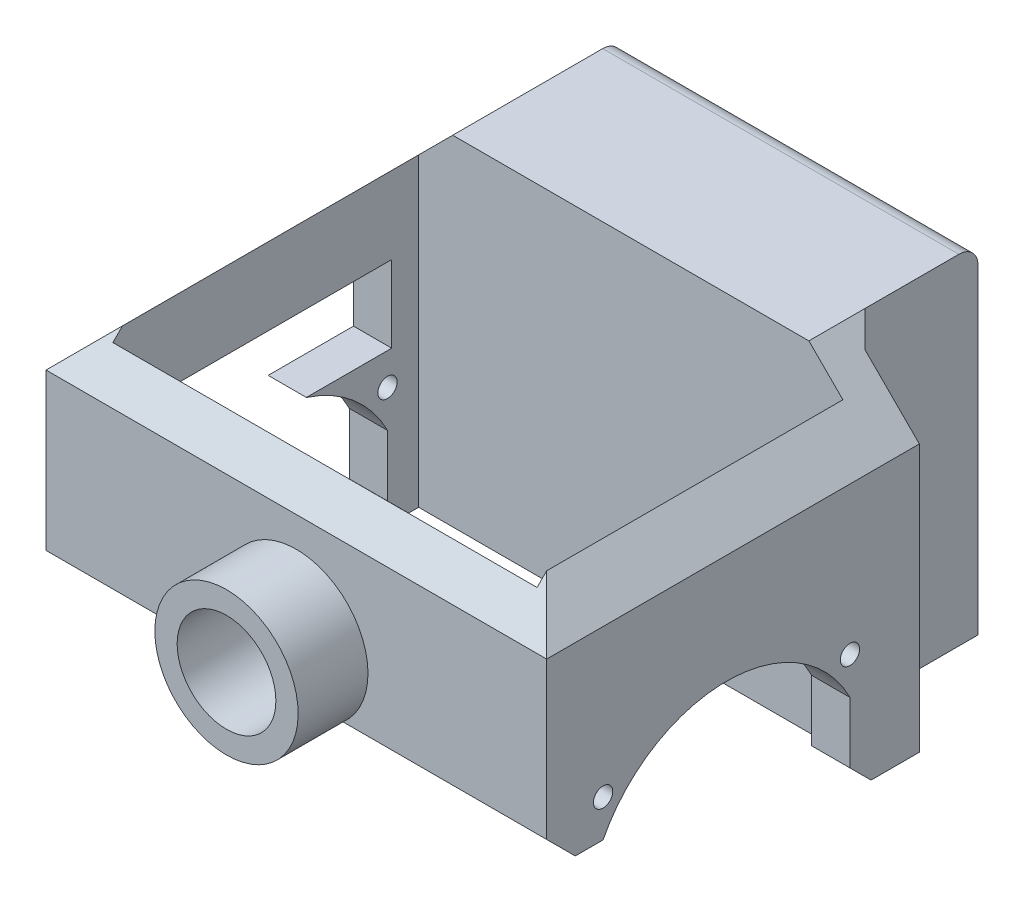
from build123d import *

# Parameters (mm, degrees)
SKETCH1_W                       = 25
SKETCH1_H                       = 30
BOSS_EXTRUDE1_DEPTH             = 3.175
SKETCH2_W                       = 25
SKETCH2_H                       = 3.175
BOSS_EXTRUDE2_DEPTH             = 41.58
SKETCH3_W                       = 3.175
SKETCH3_H                       = 25
BOSS_EXTRUDE3_DEPTH             = 30
CUT_EXTRUDE1_REACH              = 60.775
SKETCH4_R                       = 11.5
CUT_EXTRUDE2_REACH              = 60.775
SKETCH5_R                       = 0.8
CUT_EXTRUDE3_REACH              = 60.775
SKETCH6_R                       = 0.8
SKETCH6_R_2                     = 0.799851166
SKETCH6_W                       = 21.2
SKETCH6_H                       = 6.375
CUT_EXTRUDE4_REACH              = 60.775
SKETCH7_R                       = 11.5
BOSS_EXTRUDE4_DEPTH             = 0.2
SKETCH9_W                       = 41.58
SKETCH9_H                       = 33.175
BOSS_EXTRUDE5_DEPTH             = 3.175
BOSS_EXTRUDE6_DEPTH             = 0.2
SKETCH11_W                      = 41.58
SKETCH11_H                      = 33.175
BOSS_EXTRUDE7_DEPTH             = 3.175
CHAMFER1_SIZE                   = 3.175
CHAMFER2_SIZE                   = 3.175
SKETCH13_W                      = 29.58
SKETCH13_H                      = 3.175
BOSS_EXTRUDE8_DEPTH             = 7.695
BOSS_EXTRUDE9_REACH             = 59.968
SKETCH14_W                      = 29.58
SKETCH14_H                      = 3.5
BOSS_EXTRUDE9_DIRECTION_2_DEPTH = 25
FILLET1_R                       = 1.5875
FILLET2_R                       = 1.5875
CUT_EXTRUDE5_REACH              = 70.161
SKETCH16_R                      = 7.1
SKETCH20_R                      = 8
SKETCH20_R_2                    = 4.1
BOSS_EXTRUDE11_DEPTH            = 5
CUT_EXTRUDE6_START              = -21.7275
SKETCH21_R                      = 1.025
CUT_EXTRUDE6_DEPTH              = 16
BOSS_EXTRUDE12_DEPTH            = 5
BOSS_EXTRUDE12_DEPTH_BACK       = 1.2
SKETCH23_R                      = 5.95
SKETCH23_R_2                    = 4.1
CUT_EXTRUDE9_START              = -0.8
SKETCH35_W                      = 56.674577384
SKETCH35_H                      = 32.233153273
SKETCH35_R                      = 5.95
CUT_EXTRUDE9_DEPTH              = 0.8
CHAMFER4_SIZE                   = 1.5
SKETCH24_R                      = 11.5
SKETCH24_R_2                    = 10
BOSS_EXTRUDE13_DEPTH            = 1.8
SKETCH25_W                      = 108.105246784
SKETCH25_H                      = 63.591321638
CUT_EXTRUDE7_DEPTH              = 11.825
CHAMFER5_SIZE                   = 6
CUT_EXTRUDE8_START              = -3.175
SKETCH26_R                      = 4.1
CUT_EXTRUDE8_DEPTH              = 3.175
BOSS_EXTRUDE14_START            = 1.975
BOSS_EXTRUDE14_DEPTH            = 1.975
BOSS_EXTRUDE16_START            = 3.5
SKETCH29_R                      = 7.1
SKETCH29_R_2                    = 4.1
BOSS_EXTRUDE16_DEPTH            = 3.5
BOSS_EXTRUDE17_REACH            = 66.275
SKETCH31_W                      = 3.175
SKETCH31_H                      = 26.839044126
BOSS_EXTRUDE18_DEPTH            = 6.825
SKETCH34_R                      = 8
BOSS_EXTRUDE19_DEPTH            = 2.37
CHAMFER7_SIZE                   = 3.175
CHAMFER8_SIZE                   = 1.75


# Some blends are built 0.0001 mm under size
with BuildPart() as part:
    # Sketch1 → Boss-Extrude1 (new body)
    with BuildSketch(Plane(origin=(0, 0, 0), x_dir=(0, 0, -1), z_dir=(1, 0, 0))):
        with Locations((12.5, 15)):
            Rectangle(SKETCH1_W, SKETCH1_H)
    extrude(amount=BOSS_EXTRUDE1_DEPTH)

    # Sketch2 → Boss-Extrude2 (add)
    with BuildSketch(Plane.ZY):
        with Locations((-12.5, 31.5875)):
            Rectangle(SKETCH2_W, SKETCH2_H)
    extrude(amount=-BOSS_EXTRUDE2_DEPTH)

    # Sketch3 → Boss-Extrude3 (add)
    with BuildSketch(Plane.XZ.offset(-30)):
        with Locations((39.9925, -12.5)):
            Rectangle(SKETCH3_W, SKETCH3_H)
    extrude(amount=BOSS_EXTRUDE3_DEPTH)

    # Sketch4 → Cut-Extrude1 (cut, up to next)
    with BuildSketch(Plane.ZY, mode=Mode.PRIVATE) as cut_extrude1_sk1:
        with Locations((-12.359999929, -5.209996254)):
            Circle(SKETCH4_R)
    cut_extrude1_tool1 = extrude(cut_extrude1_sk1.sketch, amount=-CUT_EXTRUDE1_REACH, mode=Mode.PRIVATE) & part.part
    add(cut_extrude1_tool1.solids().sort_by_distance((0, -5.209996, -12.36))[0], mode=Mode.SUBTRACT)

    # Sketch5 → Cut-Extrude2 (cut, up to next)
    with BuildSketch(Plane.ZY, mode=Mode.PRIVATE) as cut_extrude2_sk1:
        with Locations((-22.609999929, 3.090003746)):
            Circle(SKETCH5_R)
    cut_extrude2_tool1 = extrude(cut_extrude2_sk1.sketch, amount=-CUT_EXTRUDE2_REACH, mode=Mode.PRIVATE) & part.part
    # Sketch5 → Cut-Extrude2 (cut, up to next)
    with BuildSketch(Plane.ZY, mode=Mode.PRIVATE) as cut_extrude2_sk2:
        with Locations((-22.609999929, 23.790003746)):
            Circle(SKETCH5_R)
    cut_extrude2_tool2 = extrude(cut_extrude2_sk2.sketch, amount=-CUT_EXTRUDE2_REACH, mode=Mode.PRIVATE) & part.part
    # Sketch5 → Cut-Extrude2 (cut, up to next)
    with BuildSketch(Plane.ZY, mode=Mode.PRIVATE) as cut_extrude2_sk3:
        with Locations((-2.109999929, 23.790003746)):
            Circle(SKETCH5_R)
    cut_extrude2_tool3 = extrude(cut_extrude2_sk3.sketch, amount=-CUT_EXTRUDE2_REACH, mode=Mode.PRIVATE) & part.part
    # Sketch5 → Cut-Extrude2 (cut, up to next)
    with BuildSketch(Plane.ZY, mode=Mode.PRIVATE) as cut_extrude2_sk4:
        with Locations((-2.109999929, 3.090003746)):
            Circle(SKETCH5_R)
    cut_extrude2_tool4 = extrude(cut_extrude2_sk4.sketch, amount=-CUT_EXTRUDE2_REACH, mode=Mode.PRIVATE) & part.part
    add(cut_extrude2_tool1.solids().sort_by_distance((0, 3.090004, -22.61))[0], mode=Mode.SUBTRACT)
    add(cut_extrude2_tool2.solids().sort_by_distance((0, 23.790004, -22.61))[0], mode=Mode.SUBTRACT)
    add(cut_extrude2_tool3.solids().sort_by_distance((0, 23.790004, -2.11))[0], mode=Mode.SUBTRACT)
    add(cut_extrude2_tool4.solids().sort_by_distance((0, 3.090004, -2.11))[0], mode=Mode.SUBTRACT)

    # Sketch6 → Cut-Extrude3 (cut, up to next)
    with BuildSketch(Plane(origin=(41.58, 0, 0), x_dir=(0, 0, -1), z_dir=(1, 0, 0)), mode=Mode.PRIVATE) as cut_extrude3_sk1:
        with Locations(Location((2.109999929, 3.090003746, 0), (0, 0, 180))):
            Circle(SKETCH6_R)
    cut_extrude3_tool1 = extrude(cut_extrude3_sk1.sketch, amount=-CUT_EXTRUDE3_REACH, mode=Mode.PRIVATE) & part.part
    # Sketch6 → Cut-Extrude3 (cut, up to next)
    with BuildSketch(Plane(origin=(41.58, 0, 0), x_dir=(0, 0, -1), z_dir=(1, 0, 0)), mode=Mode.PRIVATE) as cut_extrude3_sk2:
        with Locations(Location((22.609999929, 3.090003746, 0), (0, 0, 180))):
            Circle(SKETCH6_R)
    cut_extrude3_tool2 = extrude(cut_extrude3_sk2.sketch, amount=-CUT_EXTRUDE3_REACH, mode=Mode.PRIVATE) & part.part
    # Sketch6 → Cut-Extrude3 (cut, up to next)
    with BuildSketch(Plane(origin=(41.58, 0, 0), x_dir=(0, 0, -1), z_dir=(1, 0, 0)), mode=Mode.PRIVATE) as cut_extrude3_sk3:
        with Locations((22.609999929, 27.540003746)):
            Circle(SKETCH6_R_2)
    cut_extrude3_tool3 = extrude(cut_extrude3_sk3.sketch, amount=-CUT_EXTRUDE3_REACH, mode=Mode.PRIVATE) & part.part
    # Sketch6 → Cut-Extrude3 (cut, up to next)
    with BuildSketch(Plane(origin=(41.58, 0, 0), x_dir=(0, 0, -1), z_dir=(1, 0, 0)), mode=Mode.PRIVATE) as cut_extrude3_sk4:
        with Locations((2.109999929, 27.540003746)):
            Circle(SKETCH6_R)
    cut_extrude3_tool4 = extrude(cut_extrude3_sk4.sketch, amount=-CUT_EXTRUDE3_REACH, mode=Mode.PRIVATE) & part.part
    # Sketch6 → Cut-Extrude3 (cut, up to next)
    with BuildSketch(Plane(origin=(41.58, 0, 0), x_dir=(0, 0, -1), z_dir=(1, 0, 0)), mode=Mode.PRIVATE) as cut_extrude3_sk5:
        with Locations((12.359999929, 8.927503746)):
            Rectangle(SKETCH6_W, SKETCH6_H)
    cut_extrude3_tool5 = extrude(cut_extrude3_sk5.sketch, amount=-CUT_EXTRUDE3_REACH, mode=Mode.PRIVATE) & part.part
    add(cut_extrude3_tool1.solids().sort_by_distance((41.58, 3.090004, -2.11))[0], mode=Mode.SUBTRACT)
    add(cut_extrude3_tool2.solids().sort_by_distance((41.58, 3.090004, -22.61))[0], mode=Mode.SUBTRACT)
    add(cut_extrude3_tool3.solids().sort_by_distance((41.58, 27.540004, -22.61))[0], mode=Mode.SUBTRACT)
    add(cut_extrude3_tool4.solids().sort_by_distance((41.58, 27.540004, -2.11))[0], mode=Mode.SUBTRACT)
    add(cut_extrude3_tool5.solids().sort_by_distance((41.58, 8.927504, -12.36))[0], mode=Mode.SUBTRACT)

    # Sketch7 → Cut-Extrude4 (cut, up to next)
    with BuildSketch(Plane(origin=(41.58, 0, 0), x_dir=(0, 0, -1), z_dir=(1, 0, 0)), mode=Mode.PRIVATE) as cut_extrude4_sk1:
        with Locations((12.359999929, -5.209996254)):
            Circle(SKETCH7_R)
    cut_extrude4_tool1 = extrude(cut_extrude4_sk1.sketch, amount=-CUT_EXTRUDE4_REACH, mode=Mode.PRIVATE) & part.part
    add(cut_extrude4_tool1.solids().sort_by_distance((41.58, -5.209996, -12.36))[0], mode=Mode.SUBTRACT)

    # Sketch8 → Boss-Extrude4 (add)
    with BuildSketch(Plane.XY):
        Polygon((0, 33.175), (0, 0), (3.175, 0), (3.175, 30), (38.405, 30), (38.405, 0), (41.58, 0), (41.58, 33.175), align=None)
    extrude(amount=BOSS_EXTRUDE4_DEPTH)

    # Sketch9 → Boss-Extrude5 (add)
    with BuildSketch(Plane.XY.offset(0.2)):
        with Locations((20.79, 16.5875)):
            Rectangle(SKETCH9_W, SKETCH9_H)
    extrude(amount=BOSS_EXTRUDE5_DEPTH)

    # Sketch10 → Boss-Extrude6 (add)
    with BuildSketch(Plane(origin=(0, 0, -25), x_dir=(-1, 0, 0), z_dir=(0, 0, -1))):
        Polygon((0, 0), (0, 33.175), (-41.58, 33.175), (-41.58, 0), (-38.405, 0), (-38.405, 30), (-3.175, 30), (-3.175, 0), align=None)
    extrude(amount=BOSS_EXTRUDE6_DEPTH)

    # Sketch11 → Boss-Extrude7 (add)
    with BuildSketch(Plane(origin=(0, 0, -25.2), x_dir=(-1, 0, 0), z_dir=(0, 0, -1))):
        with Locations((-20.79, 16.5875)):
            Rectangle(SKETCH11_W, SKETCH11_H)
    extrude(amount=BOSS_EXTRUDE7_DEPTH)

    # Chamfer1
    chamfer1_edges = [part.edges().sort_by_distance(p)[0] for p in [
        (20.79, 33.175, 3.375),
        (20.79, 33.175, -28.375),
    ]]
    chamfer(chamfer1_edges, length=CHAMFER1_SIZE)

    # Chamfer2
    chamfer2_edges = [part.edges().sort_by_distance(p)[0] for p in [
        (20.79, 0, 3.375),
    ]]
    chamfer(chamfer2_edges, length=CHAMFER2_SIZE - 0.0001)  # a hair under: the kernel refuses the full size

    # Sketch13 → Boss-Extrude8 (add)
    with BuildSketch(Plane(origin=(0, 0, -28.375), x_dir=(-1, 0, 0), z_dir=(0, 0, -1))):
        with Locations((-20.79, 19.7625)):
            Rectangle(SKETCH13_W, SKETCH13_H)
    extrude(amount=BOSS_EXTRUDE8_DEPTH)

    # Boss-Extrude9: up to this face of the body (flat: up to its plane)
    boss_extrude9_end = Plane(part.part.faces().sort_by_distance((20.79, 21.35, -32.2225))[0])
    # Sketch14 → Boss-Extrude9 (add, up to the picked face)
    with BuildSketch(Plane.XZ.offset(-18.175), mode=Mode.PRIVATE) as boss_extrude9_sk1:
        with Locations((20.79, -37.495)):
            Rectangle(SKETCH14_W, SKETCH14_H)
    boss_extrude9_tool1 = split(extrude(boss_extrude9_sk1.sketch, amount=-BOSS_EXTRUDE9_REACH, mode=Mode.PRIVATE), bisect_by=boss_extrude9_end, keep=Keep.BOTH, mode=Mode.PRIVATE)
    add(boss_extrude9_tool1.solids().sort_by(Axis((20.79, 18.175, -37.495), (0, 1, 0)))[0])

    # Sketch14 → Boss-Extrude9 direction 2 (add)
    with BuildSketch(Plane.XZ.offset(-18.175)):
        with Locations((20.79, -37.495)):
            Rectangle(SKETCH14_W, SKETCH14_H)
    extrude(amount=BOSS_EXTRUDE9_DIRECTION_2_DEPTH)

    # Fillet1
    fillet1_edges = [part.edges().sort_by_distance(p)[0] for p in [
        (20.79, 18.175, -35.745),
        (20.79, 21.35, -39.245),
    ]]
    fillet(fillet1_edges, radius=FILLET1_R)

    # Fillet2
    fillet2_edges = [part.edges().sort_by_distance(p)[0] for p in [
        (20.79, 21.35, -28.375),
    ]]
    fillet(fillet2_edges, radius=FILLET2_R)

    # Sketch16 → Cut-Extrude5 (cut, up to next)
    with BuildSketch(Plane(origin=(0, 0, -39.245), x_dir=(-1, 0, 0), z_dir=(0, 0, -1)), mode=Mode.PRIVATE) as cut_extrude5_sk1:
        with Locations((-20.79, 6.9025)):
            Circle(SKETCH16_R)
    cut_extrude5_tool1 = extrude(cut_extrude5_sk1.sketch, amount=-CUT_EXTRUDE5_REACH, mode=Mode.PRIVATE) & part.part
    add(cut_extrude5_tool1.solids().sort_by_distance((20.79, 6.9025, -39.245))[0], mode=Mode.SUBTRACT)

    # Sketch20 → Boss-Extrude11 (add)
    with BuildSketch(Plane.XY.offset(-35.745)):
        with Locations(Location((20.79, 6.9025, 0), (0, 0, 180))):
            Circle(SKETCH20_R)
        with Locations((20.79, 6.9025)):
            Circle(SKETCH20_R_2, mode=Mode.SUBTRACT)
    extrude(amount=BOSS_EXTRUDE11_DEPTH)

    # Sketch21 → Cut-Extrude6 (cut)
    with BuildSketch(Plane.XZ.offset(6.825).offset(CUT_EXTRUDE6_START)):
        with Locations(Location((20.79, -33.245, 0), (0, 0, 270))):
            Circle(SKETCH21_R)
    extrude(amount=CUT_EXTRUDE6_DEPTH, mode=Mode.SUBTRACT)

    # Sketch23 → Boss-Extrude12 (add, two sides: drawn at the far end of the back side and taken through both)
    with BuildSketch(Plane.XY.offset(3.375).offset(-BOSS_EXTRUDE12_DEPTH_BACK)):
        with Locations(Location((20.79, 6.9025, 0), (0, 0, 218.790206305))):
            Circle(SKETCH23_R)
        with Locations((20.79, 6.9025)):
            Circle(SKETCH23_R_2, mode=Mode.SUBTRACT)
    extrude(amount=BOSS_EXTRUDE12_DEPTH + BOSS_EXTRUDE12_DEPTH_BACK)

    # Sketch35 → Cut-Extrude9 (cut)
    with BuildSketch(Plane.XY.offset(3.375).offset(CUT_EXTRUDE9_START)):
        with Locations((23.209536951, 5.991217874)):
            Rectangle(SKETCH35_W, SKETCH35_H)
        with Locations(Location((20.79, 6.9025, 0), (0, 0, 229.545756186))):
            Circle(SKETCH35_R, mode=Mode.SUBTRACT)
    extrude(amount=CUT_EXTRUDE9_DEPTH, mode=Mode.SUBTRACT)

    # Chamfer4
    chamfer4_edges = [part.edges().sort_by_distance(p)[0] for p in [
        (35.58, 20.55625, -28.375),
        (20.79, 18.175, -28.375),
        (6, 20.55625, -28.375),
    ]]
    chamfer(chamfer4_edges, length=CHAMFER4_SIZE)

    # Sketch24 → Boss-Extrude13 (add)
    with BuildSketch(Plane(origin=(0, 0, -39.245), x_dir=(-1, 0, 0), z_dir=(0, 0, -1))):
        with Locations(Location((-20.79, 6.9025, 0), (0, 0, 180))):
            Circle(SKETCH24_R)
        with Locations((-20.79, 6.9025)):
            Circle(SKETCH24_R_2, mode=Mode.SUBTRACT)
    extrude(amount=BOSS_EXTRUDE13_DEPTH)

    # Sketch25 → Cut-Extrude7 (cut)
    with BuildSketch(Plane(origin=(0, 33.175, 0), x_dir=(1, 0, 0), z_dir=(0, 1, 0))):
        with Locations((27.427563227, 10.078434484)):
            Rectangle(SKETCH25_W, SKETCH25_H)
    extrude(amount=-CUT_EXTRUDE7_DEPTH, mode=Mode.SUBTRACT)

    # Chamfer5
    # the kernel refuses this chamfer: 6 mm, written as the material it takes off along each edge
    with BuildSketch(Plane(origin=(41.58, 21.35, -43.805097928), x_dir=(0.027495876610586775, -0.9996219169112968, 0), z_dir=(0, 0, 1)), Plane(origin=(0, 21.35, 18.005097928), x_dir=(-0.02749587661058637, -0.9996219169112968, 0), z_dir=(0, 0, -1))) as chamfer5_piece_1:
        Polygon((CHAMFER5_SIZE * 0.999621916911, -CHAMFER5_SIZE * 0.0274958766106), (-CHAMFER5_SIZE * 0.0274958766106, -CHAMFER5_SIZE * 0.999621916911), (0, 0), align=None)
    extrude(amount=61.810195856, mode=Mode.SUBTRACT)
    with BuildSketch(Plane(origin=(57.010097928, 21.35, 2.575), x_dir=(0, -0.9996219169112969, 0.027495876610586348), z_dir=(-1, 0, 0))) as chamfer5_piece_2:
        Polygon((CHAMFER5_SIZE * 0.999621916911, -CHAMFER5_SIZE * 0.0274958766106), (-CHAMFER5_SIZE * 0.0274958766106, -CHAMFER5_SIZE * 0.999621916911), (0, 0), align=None)
    extrude(amount=72.440195856, mode=Mode.SUBTRACT)

    # Sketch26 → Cut-Extrude8 (cut)
    with BuildSketch(Plane.XY.offset(3.375).offset(CUT_EXTRUDE8_START)):
        with Locations((20.79, 6.9025)):
            Circle(SKETCH26_R)
    extrude(amount=CUT_EXTRUDE8_DEPTH, mode=Mode.SUBTRACT)

    # Sketch27 → Boss-Extrude14 (add)
    with BuildSketch(Plane(origin=(0, 0, 2.175), x_dir=(-1, 0, 0), z_dir=(0, 0, -1)).offset(BOSS_EXTRUDE14_START)):
        with BuildLine():
            Line((-17.454997189, 1.975), (-24.125002811, 1.975))
            ThreePointArc((-24.125002811, 1.975), (-20.79, 0.9525), (-17.454997189, 1.975))
        make_face()
    extrude(amount=-BOSS_EXTRUDE14_DEPTH)

    # Sketch29 → Boss-Extrude16 (add)
    with BuildSketch(Plane(origin=(0, 0, -35.745), x_dir=(-1, 0, 0), z_dir=(0, 0, -1)).offset(BOSS_EXTRUDE16_START)):
        with Locations((-20.79, 6.9025)):
            Circle(SKETCH29_R)
        with Locations(Location((-20.79, 6.9025, 0), (0, 0, 180))):
            Circle(SKETCH29_R_2, mode=Mode.SUBTRACT)
    extrude(amount=-BOSS_EXTRUDE16_DEPTH)

    # Boss-Extrude17: up to this face of the body (flat: up to its plane)
    boss_extrude17_end = Plane(part.part.faces().sort_by_distance((20.79, 8.452730204, -28.375))[0])
    # Sketch31 → Boss-Extrude17 (add, up to the picked face)
    with BuildSketch(Plane.XY.offset(-35.745), mode=Mode.PRIVATE) as boss_extrude17_sk1:
        with Locations((7.5875, 6.594522063)):
            Rectangle(SKETCH31_W, SKETCH31_H)
    boss_extrude17_tool1 = split(extrude(boss_extrude17_sk1.sketch, amount=BOSS_EXTRUDE17_REACH, mode=Mode.PRIVATE), bisect_by=boss_extrude17_end, keep=Keep.BOTH, mode=Mode.PRIVATE)
    # Sketch31 → Boss-Extrude17 (add, up to the picked face)
    with BuildSketch(Plane.XY.offset(-35.745), mode=Mode.PRIVATE) as boss_extrude17_sk2:
        with Locations((33.9925, 6.594522063)):
            Rectangle(SKETCH31_W, SKETCH31_H)
    boss_extrude17_tool2 = split(extrude(boss_extrude17_sk2.sketch, amount=BOSS_EXTRUDE17_REACH, mode=Mode.PRIVATE), bisect_by=boss_extrude17_end, keep=Keep.BOTH, mode=Mode.PRIVATE)
    add(boss_extrude17_tool1.solids().sort_by(Axis((7.5875, 6.594522, -35.745), (0, 0, 1)))[0])
    add(boss_extrude17_tool2.solids().sort_by(Axis((33.9925, 6.594522, -35.745), (0, 0, 1)))[0])

    # Sketch33 → Boss-Extrude18 (add)
    with BuildSketch(Plane.XZ):
        Polygon((3.175, -25.2), (3.175, -22.612118687), (0, -22.612118687), (0, -28.375), (6, -28.375), (9.175, -28.375), (32.405, -28.375), (35.58, -28.375), (41.58, -28.375), (41.58, -22.612118687), (38.405, -22.612118687), (38.405, -25.2), align=None)
    extrude(amount=BOSS_EXTRUDE18_DEPTH)

    # Sketch34 → Boss-Extrude19 (add)
    with BuildSketch(Plane.XY.offset(-30.745)):
        with Locations(Location((20.79, 6.9025, 0), (0, 0, 180))):
            Circle(SKETCH34_R)
    extrude(amount=BOSS_EXTRUDE19_DEPTH)

    # Chamfer7
    chamfer7_edges = [part.edges().sort_by_distance(p)[0] for p in [
        (20.79, -6.825, -35.745),
        (20.79, -6.825, -28.375),
    ]]
    chamfer(chamfer7_edges, length=CHAMFER7_SIZE - 0.0001)  # a hair under: the kernel refuses the full size

    # Chamfer8
    chamfer8_edges = [part.edges().sort_by_distance(p)[0] for p in [
        (39.9925, -6.825, -22.612118687),
        (1.5875, -6.825, -22.612118687),
    ]]
    chamfer(chamfer8_edges, length=CHAMFER8_SIZE)


with BuildPart() as body_2:
    # Mirror1: mirrored copy
    add(part.part.mirror(Plane(origin=(51.58, 0, 0), x_dir=(0, 0, 1), z_dir=(1, 0, 0))))


solid = body_2.part
